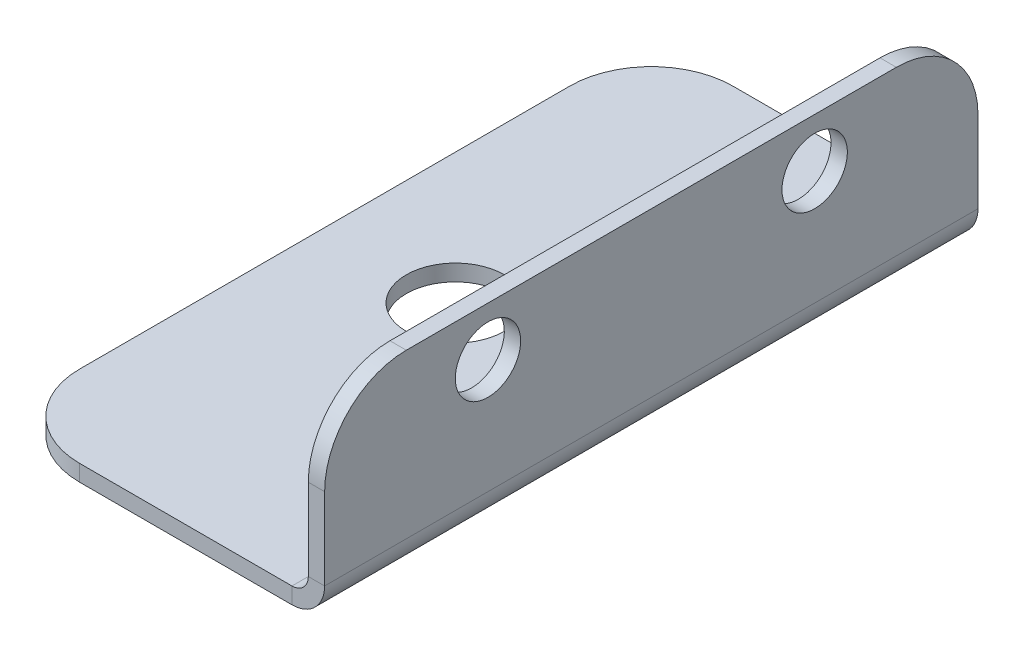
from build123d import *

# Parameters (mm, degrees)
BASE_FLANGE1_DEPTH      = 40
CUT_EXTRUDE1_DEPTH      = 47.054315759
CUT_EXTRUDE1_DEPTH_BACK = 47.054315759
SKETCH6_R               = 3
CUT_EXTRUDE2_DEPTH      = 46.880278988
CUT_EXTRUDE2_DEPTH_BACK = 46.880278988
SKETCH7_R               = 2
FILLET1_R               = 5


# Sheet-metal steps are written as plain solids
with BuildPart() as part:
    # Sketch1 → Base-Flange1 (new body)
    with BuildSketch(Plane.XY):
        with BuildLine():
            Line((0, 12), (0, 2))
            ThreePointArc((0, 2), (-0.585786438, 0.585786438), (-2, 0))
            Line((-2, 0), (-20, 0))
            Line((-20, 0), (-20, 1))
            Line((-20, 1), (-2, 1))
            ThreePointArc((-2, 1), (-1.292893219, 1.292893219), (-1, 2))
            Line((-1, 2), (-1, 12))
            Line((-1, 12), (0, 12))
        make_face()
    extrude(amount=BASE_FLANGE1_DEPTH)

    # Sketch6 → Cut-Extrude1 (cut, two sides: drawn at the far end of the back side and taken through both)
    with BuildSketch(Plane(origin=(0, 1, 0), x_dir=(1, 0, 0), z_dir=(0, 1, 0)).offset(-CUT_EXTRUDE1_DEPTH_BACK)):
        with Locations(Location((-12, -20, 0), (0, 0, 180))):
            Circle(SKETCH6_R)
    extrude(amount=CUT_EXTRUDE1_DEPTH + CUT_EXTRUDE1_DEPTH_BACK, mode=Mode.SUBTRACT)

    # Sketch7 → Cut-Extrude2 (cut, two sides: drawn at the far end of the back side and taken through both)
    with BuildSketch(Plane.ZY.offset(1).offset(-CUT_EXTRUDE2_DEPTH_BACK)):
        with Locations((10, 9)):
            Circle(SKETCH7_R)
        with Locations((30, 9)):
            Circle(SKETCH7_R)
    extrude(amount=CUT_EXTRUDE2_DEPTH + CUT_EXTRUDE2_DEPTH_BACK, mode=Mode.SUBTRACT)

    # Fillet1
    fillet1_edges = [part.edges().sort_by_distance(p)[0] for p in [
        (-0.5, 12, 40),
        (-0.5, 12, 0),
        (-20, 0.5, 40),
        (-20, 0.5, 0),
    ]]
    fillet(fillet1_edges, radius=FILLET1_R)


solid = part.part
